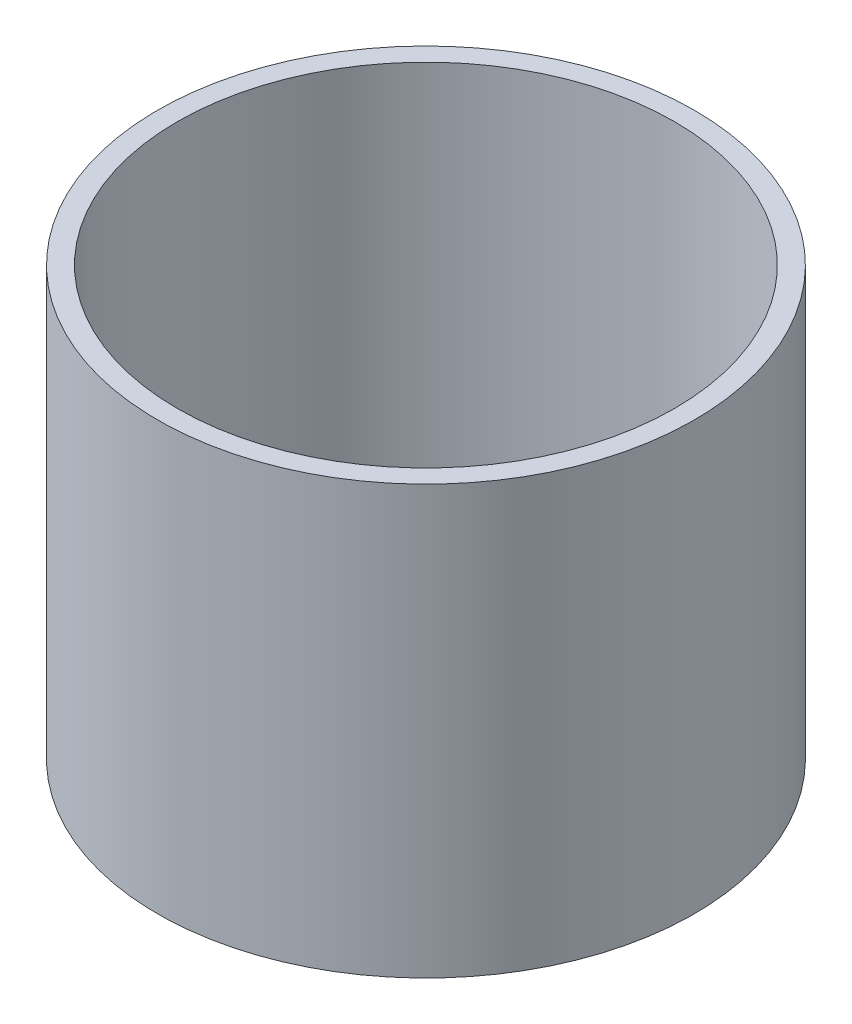
from build123d import *

# Parameters (mm, degrees)
SKETCH1_R             = 13.55
BOSS_EXTRUDE1_DEPTH   = 21.6
SHELL4_T              = -1
M2X0_4_TAPPED_HOLE1_D = 1.6
SKETCH4_R             = 4.35
BOSS_EXTRUDE2_DEPTH   = 1.5


with BuildPart() as part:
    # Sketch1 → Boss-Extrude1 (new body)
    with BuildSketch(Plane(origin=(0, 0, 0), x_dir=(1, 0, 0), z_dir=(0, 1, 0))):
        Circle(SKETCH1_R)
    extrude(amount=BOSS_EXTRUDE1_DEPTH)

    # Shell4
    shell4_openings = [part.faces().sort_by_distance(p)[0] for p in [
        (0, 21.6, 0),
    ]]
    offset(amount=SHELL4_T, openings=shell4_openings, kind=Kind.INTERSECTION)

    # M2x0.4 Tapped Hole1 (through all)
    with Locations(Plane(origin=(0, 21.6, 0), x_dir=(1, 0, 0), z_dir=(0, 1, 0))):
        with Locations((0, 8.768124087), (8.768124087, 0), (0, -8.768124087), (-8.768124087, 0)):
            Hole(M2X0_4_TAPPED_HOLE1_D / 2)

    # Sketch4 → Boss-Extrude2 (add)
    with BuildSketch(Plane.XZ):
        Circle(SKETCH4_R)
    extrude(amount=BOSS_EXTRUDE2_DEPTH)


solid = part.part
